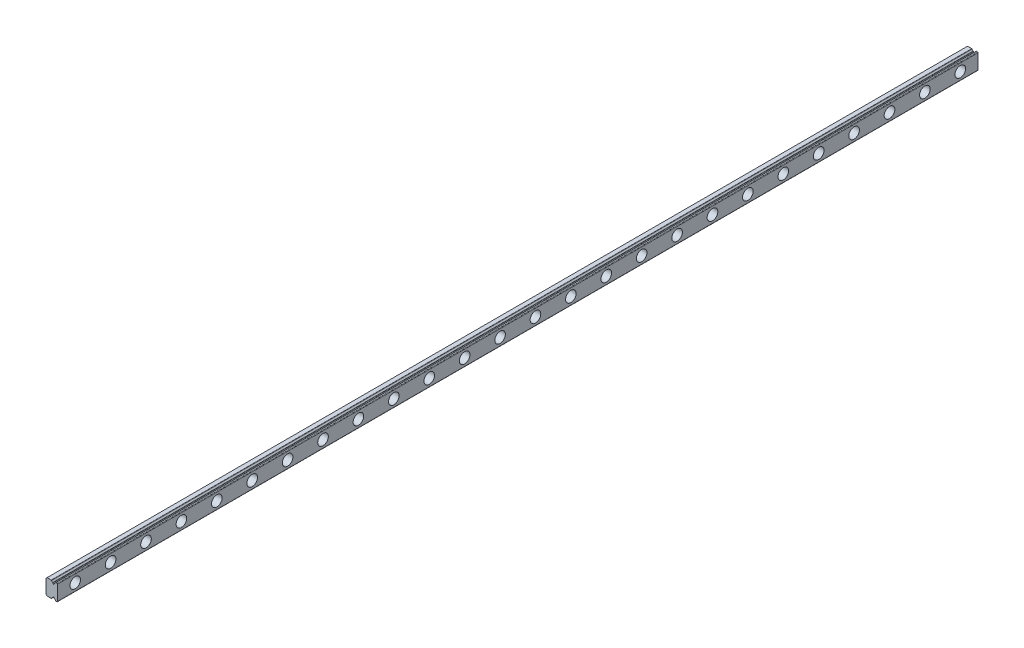
from build123d import *

# Parameters (mm, degrees)
EXTRUDE_1_DEPTH     = 400
SKETCH_2_R          = 3
CUT_EXTRUDE_1_DEPTH = 4.5
SKETCH_3_R          = 1.75
CUT_EXTRUDE_2_DEPTH = 401.126542484
CUT_EXTRUDE_4_DEPTH = 80
EXTRUDE_2_DEPTH     = 200
CUT_EXTRUDE_START   = -100
SKETCH_7_R          = 1.75
CUT_EXTRUDE_5_DEPTH = 100
SKETCH_8_R          = 3
CUT_EXTRUDE_6_DEPTH = 4.5


with BuildPart() as part:
    # 草图1 → 凸台-拉伸1 (new body)
    with BuildSketch(Plane.XY):
        with BuildLine():
            Line((0.6, 9), (0, 8.4))
            Line((0, 8.4), (0, 0.6))
            Line((0, 0.6), (0.6, 0))
            Line((0.6, 0), (2.942330317, 0))
            ThreePointArc((2.942330317, 0), (3.055719659, 0.035249106), (3.129140272, 0.128571429))
            ThreePointArc((3.129140272, 0.128571429), (3.369153549, 0.514929157), (3.735714286, 0.784209483))
            ThreePointArc((3.735714286, 0.784209483), (3.819030851, 0.858006567), (3.85, 0.964911064))
            Line((3.85, 0.964911064), (3.85, 1))
            ThreePointArc((3.85, 1), (4.25, 1.4), (4.65, 1))
            Line((4.65, 1), (4.65, 0.964911064))
            ThreePointArc((4.65, 0.964911064), (4.680969149, 0.858006567), (4.764285714, 0.784209483))
            ThreePointArc((4.764285714, 0.784209483), (5.130846451, 0.514929157), (5.370859728, 0.128571429))
            ThreePointArc((5.370859728, 0.128571429), (5.444280341, 0.035249106), (5.557669683, 0))
            Line((5.557669683, 0), (6.2, 0))
            ThreePointArc((6.2, 0), (6.412132034, 0.087867966), (6.5, 0.3))
            Line((6.5, 0.3), (6.5, 8.7))
            ThreePointArc((6.5, 8.7), (6.412132034, 8.912132034), (6.2, 9))
            Line((6.2, 9), (5.557669683, 9))
            ThreePointArc((5.557669683, 9), (5.444280341, 8.964750894), (5.370859728, 8.871428571))
            ThreePointArc((5.370859728, 8.871428571), (5.130846451, 8.485070843), (4.764285714, 8.215790517))
            ThreePointArc((4.764285714, 8.215790517), (4.680969149, 8.141993433), (4.65, 8.035088936))
            Line((4.65, 8.035088936), (4.65, 8))
            ThreePointArc((4.65, 8), (4.25, 7.6), (3.85, 8))
            Line((3.85, 8), (3.85, 8.035088936))
            ThreePointArc((3.85, 8.035088936), (3.819030851, 8.141993433), (3.735714286, 8.215790517))
            ThreePointArc((3.735714286, 8.215790517), (3.369153549, 8.485070843), (3.129140272, 8.871428571))
            ThreePointArc((3.129140272, 8.871428571), (3.055719659, 8.964750894), (2.942330317, 9))
            Line((2.942330317, 9), (0.6, 9))
        make_face()
    extrude(amount=EXTRUDE_1_DEPTH)

    # 草图2 → 切除-拉伸1 (cut)
    with BuildSketch(Plane(origin=(6.5, 0, 0), x_dir=(0, 0, -1), z_dir=(1, 0, 0))):
        with Locations((-10, 4.5)):
            Circle(SKETCH_2_R)
        with Locations((-30, 4.5)):
            Circle(SKETCH_2_R)
        with Locations((-50, 4.5)):
            Circle(SKETCH_2_R)
        with Locations((-70, 4.5)):
            Circle(SKETCH_2_R)
        with Locations((-90, 4.5)):
            Circle(SKETCH_2_R)
        with Locations((-110, 4.5)):
            Circle(SKETCH_2_R)
        with Locations((-130, 4.5)):
            Circle(SKETCH_2_R)
        with Locations((-150, 4.5)):
            Circle(SKETCH_2_R)
        with Locations((-170, 4.5)):
            Circle(SKETCH_2_R)
        with Locations((-190, 4.5)):
            Circle(SKETCH_2_R)
        with Locations((-210, 4.5)):
            Circle(SKETCH_2_R)
        with Locations((-230, 4.5)):
            Circle(SKETCH_2_R)
        with Locations((-250, 4.5)):
            Circle(SKETCH_2_R)
        with Locations((-270, 4.5)):
            Circle(SKETCH_2_R)
        with Locations((-290, 4.5)):
            Circle(SKETCH_2_R)
        with Locations((-310, 4.5)):
            Circle(SKETCH_2_R)
        with Locations((-330, 4.5)):
            Circle(SKETCH_2_R)
        with Locations((-350, 4.5)):
            Circle(SKETCH_2_R)
        with Locations((-370, 4.5)):
            Circle(SKETCH_2_R)
        with Locations((-390, 4.5)):
            Circle(SKETCH_2_R)
        with Locations((-410, 4.5)):
            Circle(SKETCH_2_R)
        with Locations((-430, 4.5)):
            Circle(SKETCH_2_R)
        with Locations((-450, 4.5)):
            Circle(SKETCH_2_R)
        with Locations((-470, 4.5)):
            Circle(SKETCH_2_R)
        with Locations((-490, 4.5)):
            Circle(SKETCH_2_R)
        with Locations((-510, 4.5)):
            Circle(SKETCH_2_R)
        with Locations((-530, 4.5)):
            Circle(SKETCH_2_R)
        with Locations((-550, 4.5)):
            Circle(SKETCH_2_R)
        with Locations((-570, 4.5)):
            Circle(SKETCH_2_R)
        with Locations((-590, 4.5)):
            Circle(SKETCH_2_R)
        with Locations((-610, 4.5)):
            Circle(SKETCH_2_R)
        with Locations((-630, 4.5)):
            Circle(SKETCH_2_R)
        with Locations((-650, 4.5)):
            Circle(SKETCH_2_R)
        with Locations((-670, 4.5)):
            Circle(SKETCH_2_R)
        with Locations((-690, 4.5)):
            Circle(SKETCH_2_R)
        with Locations((-710, 4.5)):
            Circle(SKETCH_2_R)
        with Locations((-730, 4.5)):
            Circle(SKETCH_2_R)
        with Locations((-750, 4.5)):
            Circle(SKETCH_2_R)
        with Locations((-770, 4.5)):
            Circle(SKETCH_2_R)
        with Locations((-790, 4.5)):
            Circle(SKETCH_2_R)
        with Locations((-810, 4.5)):
            Circle(SKETCH_2_R)
        with Locations((-830, 4.5)):
            Circle(SKETCH_2_R)
        with Locations((-850, 4.5)):
            Circle(SKETCH_2_R)
        with Locations((-870, 4.5)):
            Circle(SKETCH_2_R)
        with Locations((-890, 4.5)):
            Circle(SKETCH_2_R)
        with Locations((-910, 4.5)):
            Circle(SKETCH_2_R)
        with Locations((-930, 4.5)):
            Circle(SKETCH_2_R)
        with Locations((-950, 4.5)):
            Circle(SKETCH_2_R)
        with Locations((-970, 4.5)):
            Circle(SKETCH_2_R)
        with Locations((-990, 4.5)):
            Circle(SKETCH_2_R)
        with Locations((-1010, 4.5)):
            Circle(SKETCH_2_R)
        with Locations((-1030, 4.5)):
            Circle(SKETCH_2_R)
        with Locations((-1050, 4.5)):
            Circle(SKETCH_2_R)
        with Locations((-1070, 4.5)):
            Circle(SKETCH_2_R)
        with Locations((-1090, 4.5)):
            Circle(SKETCH_2_R)
        with Locations((-1110, 4.5)):
            Circle(SKETCH_2_R)
        with Locations((-1130, 4.5)):
            Circle(SKETCH_2_R)
        with Locations((-1150, 4.5)):
            Circle(SKETCH_2_R)
        with Locations((-1170, 4.5)):
            Circle(SKETCH_2_R)
        with Locations((-1190, 4.5)):
            Circle(SKETCH_2_R)
        with Locations((-1210, 4.5)):
            Circle(SKETCH_2_R)
        with Locations((-1230, 4.5)):
            Circle(SKETCH_2_R)
        with Locations((-1250, 4.5)):
            Circle(SKETCH_2_R)
        with Locations((-1270, 4.5)):
            Circle(SKETCH_2_R)
        with Locations((-1290, 4.5)):
            Circle(SKETCH_2_R)
        with Locations((-1310, 4.5)):
            Circle(SKETCH_2_R)
        with Locations((-1330, 4.5)):
            Circle(SKETCH_2_R)
        with Locations((-1350, 4.5)):
            Circle(SKETCH_2_R)
        with Locations((-1370, 4.5)):
            Circle(SKETCH_2_R)
        with Locations((-1390, 4.5)):
            Circle(SKETCH_2_R)
        with Locations((-1410, 4.5)):
            Circle(SKETCH_2_R)
        with Locations((-1430, 4.5)):
            Circle(SKETCH_2_R)
        with Locations((-1450, 4.5)):
            Circle(SKETCH_2_R)
        with Locations((-1470, 4.5)):
            Circle(SKETCH_2_R)
        with Locations((-1490, 4.5)):
            Circle(SKETCH_2_R)
        with Locations((-1510, 4.5)):
            Circle(SKETCH_2_R)
        with Locations((-1530, 4.5)):
            Circle(SKETCH_2_R)
        with Locations((-1550, 4.5)):
            Circle(SKETCH_2_R)
        with Locations((-1570, 4.5)):
            Circle(SKETCH_2_R)
        with Locations((-1590, 4.5)):
            Circle(SKETCH_2_R)
        with Locations((-1610, 4.5)):
            Circle(SKETCH_2_R)
        with Locations((-1630, 4.5)):
            Circle(SKETCH_2_R)
        with Locations((-1650, 4.5)):
            Circle(SKETCH_2_R)
        with Locations((-1670, 4.5)):
            Circle(SKETCH_2_R)
        with Locations((-1690, 4.5)):
            Circle(SKETCH_2_R)
        with Locations((-1710, 4.5)):
            Circle(SKETCH_2_R)
        with Locations((-1730, 4.5)):
            Circle(SKETCH_2_R)
        with Locations((-1750, 4.5)):
            Circle(SKETCH_2_R)
        with Locations((-1770, 4.5)):
            Circle(SKETCH_2_R)
        with Locations((-1790, 4.5)):
            Circle(SKETCH_2_R)
        with Locations((-1810, 4.5)):
            Circle(SKETCH_2_R)
        with Locations((-1830, 4.5)):
            Circle(SKETCH_2_R)
        with Locations((-1850, 4.5)):
            Circle(SKETCH_2_R)
        with Locations((-1870, 4.5)):
            Circle(SKETCH_2_R)
        with Locations((-1890, 4.5)):
            Circle(SKETCH_2_R)
        with Locations((-1910, 4.5)):
            Circle(SKETCH_2_R)
        with Locations((-1930, 4.5)):
            Circle(SKETCH_2_R)
        with Locations((-1950, 4.5)):
            Circle(SKETCH_2_R)
        with Locations((-1970, 4.5)):
            Circle(SKETCH_2_R)
        with Locations((-1990, 4.5)):
            Circle(SKETCH_2_R)
        with Locations((-2010, 4.5)):
            Circle(SKETCH_2_R)
        with Locations((-2030, 4.5)):
            Circle(SKETCH_2_R)
        with Locations((-2050, 4.5)):
            Circle(SKETCH_2_R)
        with Locations((-2070, 4.5)):
            Circle(SKETCH_2_R)
        with Locations((-2090, 4.5)):
            Circle(SKETCH_2_R)
        with Locations((-2110, 4.5)):
            Circle(SKETCH_2_R)
        with Locations((-2130, 4.5)):
            Circle(SKETCH_2_R)
        with Locations((-2150, 4.5)):
            Circle(SKETCH_2_R)
        with Locations((-2170, 4.5)):
            Circle(SKETCH_2_R)
        with Locations((-2190, 4.5)):
            Circle(SKETCH_2_R)
        with Locations((-2210, 4.5)):
            Circle(SKETCH_2_R)
        with Locations((-2230, 4.5)):
            Circle(SKETCH_2_R)
        with Locations((-2250, 4.5)):
            Circle(SKETCH_2_R)
        with Locations((-2270, 4.5)):
            Circle(SKETCH_2_R)
        with Locations((-2290, 4.5)):
            Circle(SKETCH_2_R)
        with Locations((-2310, 4.5)):
            Circle(SKETCH_2_R)
        with Locations((-2330, 4.5)):
            Circle(SKETCH_2_R)
        with Locations((-2350, 4.5)):
            Circle(SKETCH_2_R)
        with Locations((-2370, 4.5)):
            Circle(SKETCH_2_R)
        with Locations((-2390, 4.5)):
            Circle(SKETCH_2_R)
        with Locations((-2410, 4.5)):
            Circle(SKETCH_2_R)
        with Locations((-2430, 4.5)):
            Circle(SKETCH_2_R)
        with Locations((-2450, 4.5)):
            Circle(SKETCH_2_R)
        with Locations((-2470, 4.5)):
            Circle(SKETCH_2_R)
    extrude(amount=-CUT_EXTRUDE_1_DEPTH, mode=Mode.SUBTRACT)

    # 草图3 → 切除-拉伸2 (cut, through all)
    with BuildSketch(Plane(origin=(2, 0, 0), x_dir=(0, 0, -1), z_dir=(1, 0, 0))):
        with Locations((-10, 4.5)):
            Circle(SKETCH_3_R)
        with Locations((-30, 4.5)):
            Circle(SKETCH_3_R)
        with Locations((-50, 4.5)):
            Circle(SKETCH_3_R)
        with Locations((-70, 4.5)):
            Circle(SKETCH_3_R)
        with Locations((-90, 4.5)):
            Circle(SKETCH_3_R)
        with Locations((-110, 4.5)):
            Circle(SKETCH_3_R)
        with Locations((-130, 4.5)):
            Circle(SKETCH_3_R)
        with Locations((-150, 4.5)):
            Circle(SKETCH_3_R)
        with Locations((-170, 4.5)):
            Circle(SKETCH_3_R)
        with Locations((-190, 4.5)):
            Circle(SKETCH_3_R)
        with Locations((-210, 4.5)):
            Circle(SKETCH_3_R)
        with Locations((-230, 4.5)):
            Circle(SKETCH_3_R)
        with Locations((-250, 4.5)):
            Circle(SKETCH_3_R)
        with Locations((-270, 4.5)):
            Circle(SKETCH_3_R)
        with Locations((-290, 4.5)):
            Circle(SKETCH_3_R)
        with Locations((-310, 4.5)):
            Circle(SKETCH_3_R)
        with Locations((-330, 4.5)):
            Circle(SKETCH_3_R)
        with Locations((-350, 4.5)):
            Circle(SKETCH_3_R)
        with Locations((-370, 4.5)):
            Circle(SKETCH_3_R)
        with Locations((-390, 4.5)):
            Circle(SKETCH_3_R)
        with Locations((-410, 4.5)):
            Circle(SKETCH_3_R)
        with Locations((-430, 4.5)):
            Circle(SKETCH_3_R)
        with Locations((-450, 4.5)):
            Circle(SKETCH_3_R)
        with Locations((-470, 4.5)):
            Circle(SKETCH_3_R)
        with Locations((-490, 4.5)):
            Circle(SKETCH_3_R)
        with Locations((-510, 4.5)):
            Circle(SKETCH_3_R)
        with Locations((-530, 4.5)):
            Circle(SKETCH_3_R)
        with Locations((-550, 4.5)):
            Circle(SKETCH_3_R)
        with Locations((-570, 4.5)):
            Circle(SKETCH_3_R)
        with Locations((-590, 4.5)):
            Circle(SKETCH_3_R)
        with Locations((-610, 4.5)):
            Circle(SKETCH_3_R)
        with Locations((-630, 4.5)):
            Circle(SKETCH_3_R)
        with Locations((-650, 4.5)):
            Circle(SKETCH_3_R)
        with Locations((-670, 4.5)):
            Circle(SKETCH_3_R)
        with Locations((-690, 4.5)):
            Circle(SKETCH_3_R)
        with Locations((-710, 4.5)):
            Circle(SKETCH_3_R)
        with Locations((-730, 4.5)):
            Circle(SKETCH_3_R)
        with Locations((-750, 4.5)):
            Circle(SKETCH_3_R)
        with Locations((-770, 4.5)):
            Circle(SKETCH_3_R)
        with Locations((-790, 4.5)):
            Circle(SKETCH_3_R)
        with Locations((-810, 4.5)):
            Circle(SKETCH_3_R)
        with Locations((-830, 4.5)):
            Circle(SKETCH_3_R)
        with Locations((-850, 4.5)):
            Circle(SKETCH_3_R)
        with Locations((-870, 4.5)):
            Circle(SKETCH_3_R)
        with Locations((-890, 4.5)):
            Circle(SKETCH_3_R)
        with Locations((-910, 4.5)):
            Circle(SKETCH_3_R)
        with Locations((-930, 4.5)):
            Circle(SKETCH_3_R)
        with Locations((-950, 4.5)):
            Circle(SKETCH_3_R)
        with Locations((-970, 4.5)):
            Circle(SKETCH_3_R)
        with Locations((-990, 4.5)):
            Circle(SKETCH_3_R)
        with Locations((-1010, 4.5)):
            Circle(SKETCH_3_R)
        with Locations((-1030, 4.5)):
            Circle(SKETCH_3_R)
        with Locations((-1050, 4.5)):
            Circle(SKETCH_3_R)
        with Locations((-1070, 4.5)):
            Circle(SKETCH_3_R)
    extrude(amount=-CUT_EXTRUDE_2_DEPTH, mode=Mode.SUBTRACT)

    # 草图5 → 切除-拉伸4 (cut)
    with BuildSketch(Plane(origin=(0, 0, 0), x_dir=(-1, 0, 0), z_dir=(0, 0, -1))):
        with BuildLine():
            Line((-6.5, 8.7), (-6.5, 0.3))
            ThreePointArc((-6.5, 0.3), (-6.412132034, 0.087867966), (-6.2, 0))
            Line((-6.2, 0), (-5.557669683, 0))
            ThreePointArc((-5.557669683, 0), (-5.444280341, 0.035249106), (-5.370859728, 0.128571429))
            ThreePointArc((-5.370859728, 0.128571429), (-5.130846451, 0.514929157), (-4.764285714, 0.784209483))
            ThreePointArc((-4.764285714, 0.784209483), (-4.680969149, 0.858006567), (-4.65, 0.964911064))
            Line((-4.65, 0.964911064), (-4.65, 1))
            ThreePointArc((-4.65, 1), (-4.25, 1.4), (-3.85, 1))
            Line((-3.85, 1), (-3.85, 0.964911064))
            ThreePointArc((-3.85, 0.964911064), (-3.819030851, 0.858006567), (-3.735714286, 0.784209483))
            ThreePointArc((-3.735714286, 0.784209483), (-3.369153549, 0.514929157), (-3.129140272, 0.128571429))
            ThreePointArc((-3.129140272, 0.128571429), (-3.055719659, 0.035249106), (-2.942330317, 0))
            Line((-2.942330317, 0), (-0.6, 0))
            Line((-0.6, 0), (0, 0.6))
            Line((0, 0.6), (0, 8.4))
            Line((0, 8.4), (-0.6, 9))
            Line((-0.6, 9), (-2.942330317, 9))
            ThreePointArc((-2.942330317, 9), (-3.055719659, 8.964750894), (-3.129140272, 8.871428571))
            ThreePointArc((-3.129140272, 8.871428571), (-3.369153549, 8.485070843), (-3.735714286, 8.215790517))
            ThreePointArc((-3.735714286, 8.215790517), (-3.819030851, 8.141993433), (-3.85, 8.035088936))
            Line((-3.85, 8.035088936), (-3.85, 8))
            ThreePointArc((-3.85, 8), (-4.25, 7.6), (-4.65, 8))
            Line((-4.65, 8), (-4.65, 8.035088936))
            ThreePointArc((-4.65, 8.035088936), (-4.680969149, 8.141993433), (-4.764285714, 8.215790517))
            ThreePointArc((-4.764285714, 8.215790517), (-5.130846451, 8.485070843), (-5.370859728, 8.871428571))
            ThreePointArc((-5.370859728, 8.871428571), (-5.444280341, 8.964750894), (-5.557669683, 9))
            Line((-5.557669683, 9), (-6.2, 9))
            ThreePointArc((-6.2, 9), (-6.412132034, 8.912132034), (-6.5, 8.7))
        make_face()
    extrude(amount=-CUT_EXTRUDE_4_DEPTH, mode=Mode.SUBTRACT)

    # 草图6 → 凸台-拉伸2 (add)
    with BuildSketch(Plane.XY.offset(400)):
        with BuildLine():
            Line((6.2, 9), (5.557669683, 9))
            ThreePointArc((5.557669683, 9), (5.444280341, 8.964750894), (5.370859728, 8.871428571))
            ThreePointArc((5.370859728, 8.871428571), (5.130846451, 8.485070843), (4.764285714, 8.215790517))
            ThreePointArc((4.764285714, 8.215790517), (4.680969149, 8.141993433), (4.65, 8.035088936))
            Line((4.65, 8.035088936), (4.65, 8))
            ThreePointArc((4.65, 8), (4.25, 7.6), (3.85, 8))
            Line((3.85, 8), (3.85, 8.035088936))
            ThreePointArc((3.85, 8.035088936), (3.819030851, 8.141993433), (3.735714286, 8.215790517))
            ThreePointArc((3.735714286, 8.215790517), (3.369153549, 8.485070843), (3.129140272, 8.871428571))
            ThreePointArc((3.129140272, 8.871428571), (3.055719659, 8.964750894), (2.942330317, 9))
            Line((2.942330317, 9), (0.6, 9))
            Line((0.6, 9), (0, 8.4))
            Line((0, 8.4), (0, 0.6))
            Line((0, 0.6), (0.6, 0))
            Line((0.6, 0), (2.942330317, 0))
            ThreePointArc((2.942330317, 0), (3.055719659, 0.035249106), (3.129140272, 0.128571429))
            ThreePointArc((3.129140272, 0.128571429), (3.369153549, 0.514929157), (3.735714286, 0.784209483))
            ThreePointArc((3.735714286, 0.784209483), (3.819030851, 0.858006567), (3.85, 0.964911064))
            Line((3.85, 0.964911064), (3.85, 1))
            ThreePointArc((3.85, 1), (4.25, 1.4), (4.65, 1))
            Line((4.65, 1), (4.65, 0.964911064))
            ThreePointArc((4.65, 0.964911064), (4.680969149, 0.858006567), (4.764285714, 0.784209483))
            ThreePointArc((4.764285714, 0.784209483), (5.130846451, 0.514929157), (5.370859728, 0.128571429))
            ThreePointArc((5.370859728, 0.128571429), (5.444280341, 0.035249106), (5.557669683, 0))
            Line((5.557669683, 0), (6.2, 0))
            ThreePointArc((6.2, 0), (6.412132034, 0.087867966), (6.5, 0.3))
            Line((6.5, 0.3), (6.5, 8.7))
            ThreePointArc((6.5, 8.7), (6.412132034, 8.912132034), (6.2, 9))
        make_face()
    extrude(amount=EXTRUDE_2_DEPTH)

    # 草图7 → 切除-拉伸5 (cut)
    with BuildSketch(Plane.ZY.offset(CUT_EXTRUDE_START)):
        with Locations((390, 4.5)):
            Circle(SKETCH_7_R)
        with Locations((410, 4.5)):
            Circle(SKETCH_7_R)
        with Locations((430, 4.5)):
            Circle(SKETCH_7_R)
        with Locations((450, 4.5)):
            Circle(SKETCH_7_R)
        with Locations((470, 4.5)):
            Circle(SKETCH_7_R)
        with Locations((490, 4.5)):
            Circle(SKETCH_7_R)
        with Locations((510, 4.5)):
            Circle(SKETCH_7_R)
        with Locations((530, 4.5)):
            Circle(SKETCH_7_R)
        with Locations((550, 4.5)):
            Circle(SKETCH_7_R)
        with Locations((570, 4.5)):
            Circle(SKETCH_7_R)
        with Locations((590, 4.5)):
            Circle(SKETCH_7_R)
    extrude(amount=CUT_EXTRUDE_5_DEPTH, mode=Mode.SUBTRACT)

    # 草图8 → 切除-拉伸6 (cut)
    with BuildSketch(Plane(origin=(6.5, 0, 0), x_dir=(0, 0, -1), z_dir=(1, 0, 0))):
        with Locations((-390, 4.5)):
            Circle(SKETCH_8_R)
        with Locations((-410, 4.5)):
            Circle(SKETCH_8_R)
        with Locations((-430, 4.5)):
            Circle(SKETCH_8_R)
        with Locations((-450, 4.5)):
            Circle(SKETCH_8_R)
        with Locations((-470, 4.5)):
            Circle(SKETCH_8_R)
        with Locations((-490, 4.5)):
            Circle(SKETCH_8_R)
        with Locations((-510, 4.5)):
            Circle(SKETCH_8_R)
        with Locations((-530, 4.5)):
            Circle(SKETCH_8_R)
        with Locations((-550, 4.5)):
            Circle(SKETCH_8_R)
        with Locations((-570, 4.5)):
            Circle(SKETCH_8_R)
        with Locations((-590, 4.5)):
            Circle(SKETCH_8_R)
    extrude(amount=-CUT_EXTRUDE_6_DEPTH, mode=Mode.SUBTRACT)


solid = part.part
